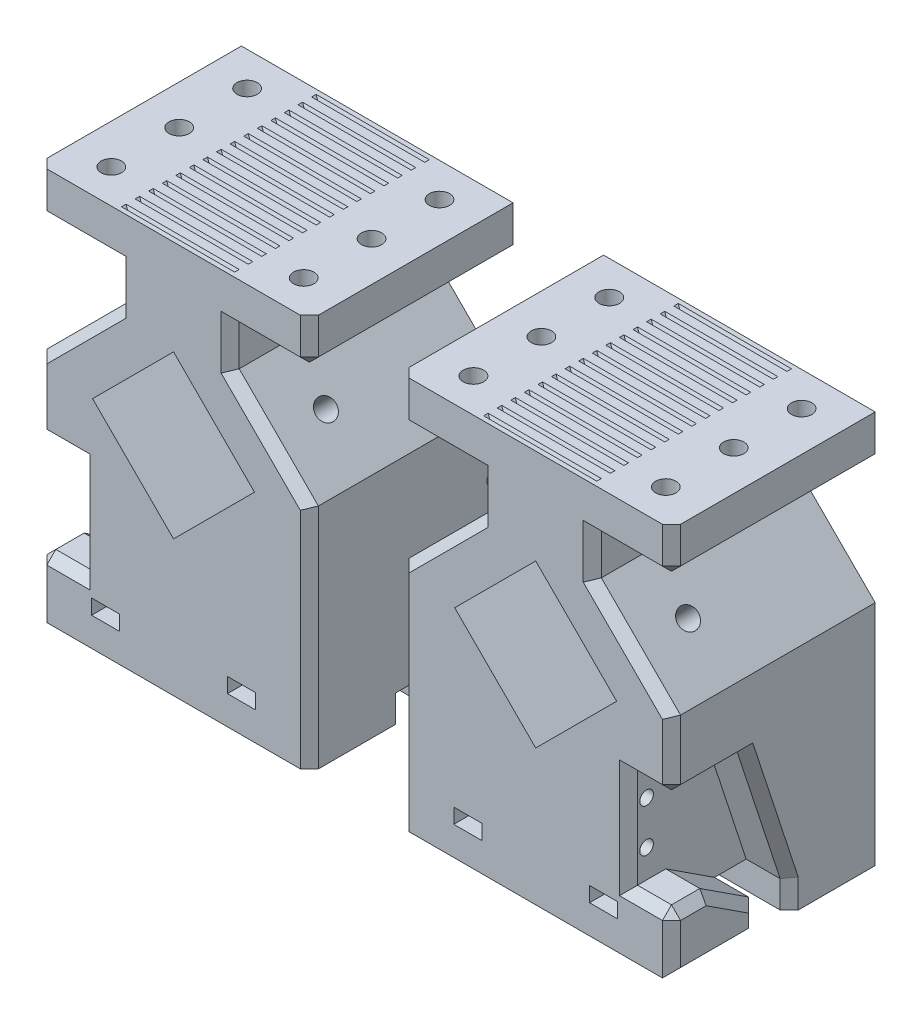
from build123d import *

# Parameters (mm, degrees)
BOSS_EXTRUDE1_DEPTH = 45
CUT_EXTRUDE1_DEPTH  = 25
CUT_EXTRUDE2_DEPTH  = 6
CUT_EXTRUDE4_DEPTH  = 9.5
CUT_EXTRUDE5_DEPTH  = 4.5
FILLET1_R           = 6
CUT_EXTRUDE7_DEPTH  = 23
CHAMFER1_SIZE       = 1
SKETCH8_R           = 2.25
CUT_EXTRUDE8_DEPTH  = 10
CUT_EXTRUDE9_DEPTH  = 3.2
SKETCH10_R          = 1.75
CUT_EXTRUDE10_DEPTH = 20
SKETCH11_W          = 6.2
SKETCH11_H          = 12
CUT_EXTRUDE11_DEPTH = 3.3
CUT_EXTRUDE12_DEPTH = 1.5
SKETCH13_R          = 1.5
CUT_EXTRUDE13_DEPTH = 15
SKETCH14_R          = 2.25
CUT_EXTRUDE14_DEPTH = 15
CUT_EXTRUDE15_DEPTH = 3.5
SKETCH16_R          = 1.8
CUT_EXTRUDE23_DEPTH = 20
SKETCH17_W          = 3.3
SKETCH17_H          = 6.2
CUT_EXTRUDE24_DEPTH = 8
CUT_EXTRUDE25_DEPTH = 1.5
CHAMFER2_SIZE       = 2


with BuildPart() as part:
    # Sketch1 → Boss-Extrude1 (new body)
    with BuildSketch(Plane.XY):
        Polygon((-30, 25.15), (-12.5, 42.65), (-12.5, 51.65), (-30, 51.65), (-30, 61.65), (30, 61.65), (30, 51.65), (12.5, 51.65), (12.5, 42.65), (30, 25.15), (30, -25.15), (-30, -25.15), align=None)
    extrude(amount=BOSS_EXTRUDE1_DEPTH)

    # Sketch2 → Cut-Extrude1 (cut)
    with BuildSketch(Plane.XY.offset(45)):
        Polygon((0, 40.629603128), (-17.889801564, 22.739801564), (0, 4.85), (17.889801564, 22.739801564), align=None)
    extrude(amount=-CUT_EXTRUDE1_DEPTH, mode=Mode.SUBTRACT)

    # Sketch3 → Cut-Extrude2 (cut)
    with BuildSketch(Plane.XZ.offset(25.15)):
        Polygon((-30, 26), (30, 26), (30, 19), (4.5, 19), (4.5, 3), (-4.5, 3), (-4.5, 19), (-30, 19), align=None)
    extrude(amount=-CUT_EXTRUDE2_DEPTH, mode=Mode.SUBTRACT)

    # Sketch4 → Cut-Extrude4 (cut)
    with BuildSketch(Plane.ZY.offset(30)):
        Polygon((45, 9.85), (28.5, 9.85), (19, -19.15), (26, -19.15), (36.75, -12.15), (45, -12.15), align=None)
    extrude(amount=-CUT_EXTRUDE4_DEPTH, mode=Mode.SUBTRACT)

    # Sketch5 → Cut-Extrude5 (cut, symmetric)
    with BuildSketch(Plane(origin=(0, 0, 0), x_dir=(0, 0, -1), z_dir=(1, 0, 0))):
        with BuildLine():
            Line((-3, -19.15), (-3, 9.566528763))
            ThreePointArc((-3, 9.566528763), (-3.277698296, 11.37076356), (-4.085087734, 13.007987381))
            Line((-4.085087734, 13.007987381), (-11.208490038, 23.181260182))
            ThreePointArc((-11.208490038, 23.181260182), (-13.352910624, 25.061866563), (-16.123402303, 25.739801564))
            Line((-16.123402303, 25.739801564), (-20, 25.739801564))
            Line((-20, 25.739801564), (-20, 19.739801564))
            Line((-20, 19.739801564), (-19.246804607, 19.739801564))
            ThreePointArc((-19.246804607, 19.739801564), (-16.476312927, 19.061866563), (-14.331892341, 17.181260182))
            Line((-14.331892341, 17.181260182), (-10.085087734, 11.116194648))
            ThreePointArc((-10.085087734, 11.116194648), (-9.277698296, 9.478970827), (-9, 7.67473603))
            Line((-9, 7.67473603), (-9, -19.15))
            Line((-9, -19.15), (-3, -19.15))
        make_face()
    extrude(amount=CUT_EXTRUDE5_DEPTH, both=True, mode=Mode.SUBTRACT)

    # Fillet1
    fillet1_edges = [part.edges().sort_by_distance(p)[0] for p in [
        (0, -19.15, 9),
    ]]
    fillet(fillet1_edges, radius=FILLET1_R)

    # Sketch7 → Cut-Extrude7 (cut)
    with BuildSketch(Plane(origin=(11.5, 0, 0), x_dir=(0, 0, -1), z_dir=(1, 0, 0))):
        Polygon((-1, 61.65), (-2, 61.65), (-1.5, 60.65), align=None)
        Polygon((-5, 61.65), (-4.5, 60.65), (-4, 61.65), align=None)
        Polygon((-8, 61.65), (-7.5, 60.65), (-7, 61.65), align=None)
        Polygon((-11, 61.65), (-10.5, 60.65), (-10, 61.65), align=None)
        Polygon((-14, 61.65), (-13.5, 60.65), (-13, 61.65), align=None)
        Polygon((-17, 61.65), (-16.5, 60.65), (-16, 61.65), align=None)
        Polygon((-20, 61.65), (-19.5, 60.65), (-19, 61.65), align=None)
        Polygon((-23, 61.65), (-22.5, 60.65), (-22, 61.65), align=None)
        Polygon((-26, 61.65), (-25.5, 60.65), (-25, 61.65), align=None)
        Polygon((-29, 61.65), (-28.5, 60.65), (-28, 61.65), align=None)
        Polygon((-32, 61.65), (-31.5, 60.65), (-31, 61.65), align=None)
        Polygon((-35, 61.65), (-34.5, 60.65), (-34, 61.65), align=None)
        Polygon((-38, 61.65), (-37.5, 60.65), (-37, 61.65), align=None)
        Polygon((-41, 61.65), (-40.5, 60.65), (-40, 61.65), align=None)
        Polygon((-44, 61.65), (-43.5, 60.65), (-43, 61.65), align=None)
        Polygon((-47, 61.65), (-46.5, 60.65), (-46, 61.65), align=None)
        Polygon((-50, 61.65), (-49.5, 60.65), (-49, 61.65), align=None)
        Polygon((-53, 61.65), (-52.5, 60.65), (-52, 61.65), align=None)
        Polygon((-56, 61.65), (-55.5, 60.65), (-55, 61.65), align=None)
        Polygon((-59, 61.65), (-58.5, 60.65), (-58, 61.65), align=None)
        Polygon((-62, 61.65), (-61.5, 60.65), (-61, 61.65), align=None)
        Polygon((-65, 61.65), (-64.5, 60.65), (-64, 61.65), align=None)
    extrude(amount=-CUT_EXTRUDE7_DEPTH, mode=Mode.SUBTRACT)

    # Chamfer1
    chamfer1_edges = [part.edges().sort_by_distance(p)[0] for p in [
        (-11.5, 61.65, 43.5),
        (-11.5, 61.65, 40.5),
        (-11.5, 61.65, 37.5),
        (-11.5, 61.65, 34.5),
        (-11.5, 61.65, 31.5),
        (-11.5, 61.65, 28.5),
        (-11.5, 61.65, 25.5),
        (-11.5, 61.65, 22.5),
        (-11.5, 61.65, 19.5),
        (-11.5, 61.65, 16.5),
        (-11.5, 61.65, 13.5),
        (-11.5, 61.65, 10.5),
        (-11.5, 61.65, 7.5),
        (-11.5, 61.65, 4.5),
        (-11.5, 61.65, 1.5),
        (11.5, 61.65, 43.5),
        (11.5, 61.65, 40.5),
        (11.5, 61.65, 37.5),
        (11.5, 61.65, 34.5),
        (11.5, 61.65, 31.5),
        (11.5, 61.65, 28.5),
        (11.5, 61.65, 25.5),
        (11.5, 61.65, 22.5),
        (11.5, 61.65, 19.5),
        (11.5, 61.65, 16.5),
        (11.5, 61.65, 13.5),
        (11.5, 61.65, 10.5),
        (11.5, 61.65, 7.5),
        (11.5, 61.65, 4.5),
        (11.5, 61.65, 1.5),
    ]]
    chamfer(chamfer1_edges, length=CHAMFER1_SIZE - 0.0001)  # a hair under: the kernel refuses the full size

    # Sketch8 → Cut-Extrude8 (cut)
    with BuildSketch(Plane(origin=(0, 61.65, 0), x_dir=(1, 0, 0), z_dir=(0, 1, 0))):
        with Locations(Location((-21.25, -37.5, 0), (0, 0, 270))):
            Circle(SKETCH8_R)
        with Locations(Location((-21.25, -22.5, 0), (0, 0, 270))):
            Circle(SKETCH8_R)
        with Locations(Location((-21.25, -7.5, 0), (0, 0, 270))):
            Circle(SKETCH8_R)
        with Locations(Location((21.25, -7.5, 0), (0, 0, 270))):
            Circle(SKETCH8_R)
        with Locations(Location((21.25, -22.5, 0), (0, 0, 270))):
            Circle(SKETCH8_R)
        with Locations(Location((21.25, -37.5, 0), (0, 0, 270))):
            Circle(SKETCH8_R)
    extrude(amount=-CUT_EXTRUDE8_DEPTH, mode=Mode.SUBTRACT)

    # Sketch9 → Cut-Extrude9 (cut)
    with BuildSketch(Plane.XZ.offset(-51.65)):
        Polygon((-25.291451884, 22.5), (-23.270725942, 19), (-19.229274058, 19), (-17.208548116, 22.5), (-19.229274058, 26), (-23.270725942, 26), align=None)
        Polygon((-25.291451884, 37.5), (-23.270725942, 34), (-19.229274058, 34), (-17.208548116, 37.5), (-19.229274058, 41), (-23.270725942, 41), align=None)
        Polygon((-25.291451884, 7.5), (-23.270725942, 4), (-19.229274058, 4), (-17.208548116, 7.5), (-19.229274058, 11), (-23.270725942, 11), align=None)
        Polygon((25.291451884, 7.5), (23.270725942, 11), (19.229274058, 11), (17.208548116, 7.5), (19.229274058, 4), (23.270725942, 4), align=None)
        Polygon((25.483397492, 22.610819848), (23.46267155, 26.110819848), (19.421219665, 26.110819848), (17.400493723, 22.610819848), (19.421219665, 19.110819848), (23.46267155, 19.110819848), align=None)
        Polygon((25.483397492, 37.610819848), (23.46267155, 41.110819848), (19.421219665, 41.110819848), (17.400493723, 37.610819848), (19.421219665, 34.110819848), (23.46267155, 34.110819848), align=None)
    extrude(amount=-CUT_EXTRUDE9_DEPTH, mode=Mode.SUBTRACT)

    # Sketch10 → Cut-Extrude10 (cut)
    with BuildSketch(Plane.XZ.offset(25.15)):
        with Locations((-15, 37.5)):
            Circle(SKETCH10_R)
        with Locations((-15, 7.5)):
            Circle(SKETCH10_R)
        with Locations((15, 7.5)):
            Circle(SKETCH10_R)
        with Locations((15, 37.5)):
            Circle(SKETCH10_R)
    extrude(amount=-CUT_EXTRUDE10_DEPTH, mode=Mode.SUBTRACT)

    # Sketch11 → Cut-Extrude11 (cut)
    with BuildSketch(Plane(origin=(0, -18.8, 0), x_dir=(-1, 0, 0), z_dir=(0, -1, 0))):
        with Locations((-15, -39)):
            Rectangle(SKETCH11_W, SKETCH11_H)
        with Locations((15, -39)):
            Rectangle(SKETCH11_W, SKETCH11_H)
        with Locations((15, -6)):
            Rectangle(SKETCH11_W, SKETCH11_H)
        with Locations((-15, -6)):
            Rectangle(SKETCH11_W, SKETCH11_H)
    extrude(amount=-CUT_EXTRUDE11_DEPTH, mode=Mode.SUBTRACT)

    # Sketch12 → Cut-Extrude12 (cut)
    with BuildSketch(Plane(origin=(0, -18.8, 0), x_dir=(-1, 0, 0), z_dir=(0, -1, 0))):
        Polygon((15, -34.035898385), (12, -35.767949192), (12, -39.232050808), (15, -40.964101615), (18, -39.232050808), (18, -35.767949192), align=None)
        Polygon((15, -10.964101615), (18, -9.232050808), (18, -5.767949192), (15, -4.035898385), (12, -5.767949192), (12, -9.232050808), align=None)
        Polygon((-15, -10.964101615), (-12, -9.232050808), (-12, -5.767949192), (-15, -4.035898385), (-18, -5.767949192), (-18, -9.232050808), align=None)
        Polygon((-15, -34.035898385), (-18, -35.767949192), (-18, -39.232050808), (-15, -40.964101615), (-12, -39.232050808), (-12, -35.767949192), align=None)
    extrude(amount=CUT_EXTRUDE12_DEPTH, mode=Mode.SUBTRACT)

    # Sketch13 → Cut-Extrude13 (cut)
    with BuildSketch(Plane.ZY.offset(20.5)):
        with Locations((41, -5.9)):
            Circle(SKETCH13_R)
        with Locations((41, 3.6)):
            Circle(SKETCH13_R)
    extrude(amount=-CUT_EXTRUDE13_DEPTH, mode=Mode.SUBTRACT)

    # Sketch14 → Cut-Extrude14 (cut)
    with BuildSketch(Plane(origin=(-27.575, 27.575, 0), x_dir=(0, 0, 1), z_dir=(-0.7071067811865477, 0.7071067811865475, 0))):
        with Locations(Location((32.5, 9.070532111, 0), (0, 0, 270))):
            Circle(SKETCH14_R)
    cut_extrude14 = extrude(amount=-CUT_EXTRUDE14_DEPTH, mode=Mode.SUBTRACT)

    # Sketch15 → Cut-Extrude15 (cut)
    with BuildSketch(Plane(origin=(-20.314801564, 20.314801564, 0), x_dir=(0, 0, -1), z_dir=(0.7071067811865477, -0.7071067811865475, 0))):
        Polygon((-28.458548116, 9.070532111), (-30.479274058, 12.570532111), (-34.520725942, 12.570532111), (-36.541451884, 9.070532111), (-34.520725942, 5.570532111), (-30.479274058, 5.570532111), align=None)
    cut_extrude15 = extrude(amount=-CUT_EXTRUDE15_DEPTH, mode=Mode.SUBTRACT)

    # Mirror1: Cut-Extrude14, Cut-Extrude15 across plane
    add(cut_extrude14.mirror(Plane(origin=(0, 0, 0), x_dir=(0, 0, 1), z_dir=(1, 0, 0))), mode=Mode.SUBTRACT)
    add(cut_extrude15.mirror(Plane(origin=(0, 0, 0), x_dir=(0, 0, 1), z_dir=(1, 0, 0))), mode=Mode.SUBTRACT)

    # Sketch16 → Cut-Extrude23 (cut)
    with BuildSketch(Plane(origin=(30, 0, 0), x_dir=(0, 0, -1), z_dir=(1, 0, 0))):
        with Locations(Location((-4, 11.25, 0), (0, 0, 90))):
            Circle(SKETCH16_R)
        with Locations(Location((-4, -11.25, 0), (0, 0, 90))):
            Circle(SKETCH16_R)
    extrude(amount=-CUT_EXTRUDE23_DEPTH, mode=Mode.SUBTRACT)

    # Sketch17 → Cut-Extrude24 (cut)
    with BuildSketch(Plane(origin=(0, 0, 0), x_dir=(-1, 0, 0), z_dir=(0, 0, -1))):
        with Locations((-22, -11.25)):
            Rectangle(SKETCH17_W, SKETCH17_H)
        with Locations((-22, 11.25)):
            Rectangle(SKETCH17_W, SKETCH17_H)
    extrude(amount=-CUT_EXTRUDE24_DEPTH, mode=Mode.SUBTRACT)

    # Sketch18 → Cut-Extrude25 (cut)
    with BuildSketch(Plane.ZY.offset(-23.65)):
        Polygon((0.824573519, 11.25), (2.41228676, 8.5), (5.58771324, 8.5), (7.175426481, 11.25), (5.58771324, 14), (2.41228676, 14), align=None)
        Polygon((0.824573519, -11.25), (2.41228676, -14), (5.58771324, -14), (7.175426481, -11.25), (5.58771324, -8.5), (2.41228676, -8.5), align=None)
    extrude(amount=-CUT_EXTRUDE25_DEPTH, mode=Mode.SUBTRACT)

    # Chamfer2
    chamfer2_edges = [part.edges().sort_by_distance(p)[0] for p in [
        (-30, -25.15, 35.5),
        (-30, -22.15, 26),
        (-30, -15.65, 31.375),
        (-30, -12.15, 40.875),
        (-30, -18.65, 45),
        (-30, -22.15, 19),
        (-30, -4.65, 23.75),
        (-30, 9.85, 36.75),
        (-25.25, -12.15, 45),
        (-20.5, -1.15, 45),
        (-25.25, 9.85, 45),
        (-30, 17.5, 45),
        (-30, 51.65, 22.5),
        (-21.25, 33.9, 45),
        (-12.5, 47.15, 45),
        (-21.25, 51.65, 45),
        (-30, 56.65, 45),
        (30, 0, 45),
        (21.25, 33.9, 45),
        (12.5, 47.15, 45),
        (21.25, 51.65, 45),
        (30, 56.65, 45),
        (30, 51.65, 22.5),
    ]]
    chamfer(chamfer2_edges, length=CHAMFER2_SIZE)


with BuildPart() as body_2:
    # Mirror4: mirrored copy
    add(part.part.mirror(Plane(origin=(40, 0, 0), x_dir=(0, 0, 1), z_dir=(1, 0, 0))))


solid = Compound([part.part, body_2.part])
